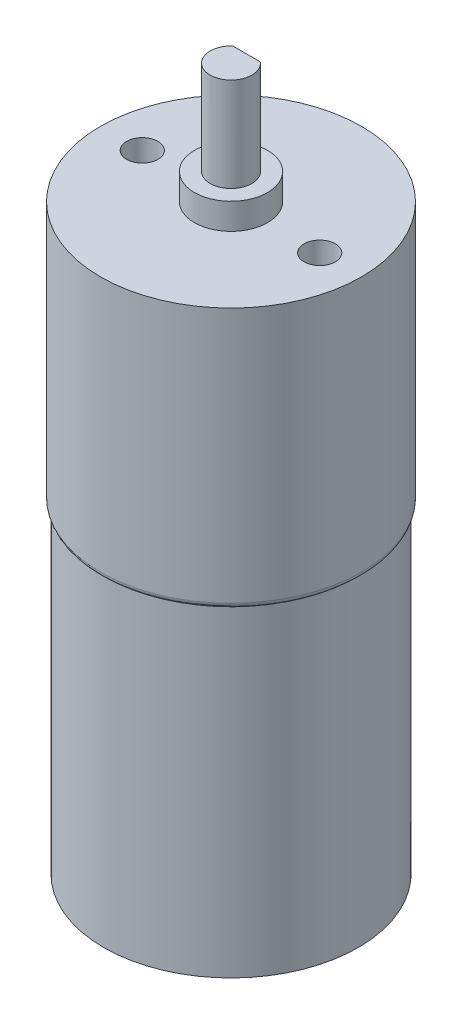
from build123d import *

# Parameters (mm, degrees)
SKETCH1_R           = 12.5
BOSS_EXTRUDE1_DEPTH = 25
FILLET1_R           = 0.5
SKETCH3_R           = 12.2
BOSS_EXTRUDE2_DEPTH = 30.8
SKETCH4_R           = 3.5
BOSS_EXTRUDE3_DEPTH = 2.5
SKETCH5_R           = 2
BOSS_EXTRUDE4_DEPTH = 9
CUT_EXTRUDE1_START  = -8
CUT_EXTRUDE1_DEPTH  = 8
SKETCH7_R           = 1.5
CUT_EXTRUDE2_DEPTH  = 5


with BuildPart() as part:
    # Sketch1 → Boss-Extrude1 (new body)
    with BuildSketch(Plane(origin=(0, 0, 0), x_dir=(1, 0, 0), z_dir=(0, 1, 0))):
        Circle(SKETCH1_R)
    extrude(amount=BOSS_EXTRUDE1_DEPTH)

    # Fillet1
    fillet1_edges = [part.edges().sort_by_distance(p)[0] for p in [
        (-12.5, 0, 0),
    ]]
    fillet(fillet1_edges, radius=FILLET1_R)

    # Sketch3 → Boss-Extrude2 (add)
    with BuildSketch(Plane.XZ):
        Circle(SKETCH3_R)
    extrude(amount=BOSS_EXTRUDE2_DEPTH)

    # Sketch4 → Boss-Extrude3 (add)
    with BuildSketch(Plane(origin=(0, 25, 0), x_dir=(1, 0, 0), z_dir=(0, 1, 0))):
        Circle(SKETCH4_R)
    extrude(amount=BOSS_EXTRUDE3_DEPTH)

    # Sketch5 → Boss-Extrude4 (add)
    with BuildSketch(Plane(origin=(0, 27.5, 0), x_dir=(1, 0, 0), z_dir=(0, 1, 0))):
        Circle(SKETCH5_R)
    extrude(amount=BOSS_EXTRUDE4_DEPTH)

    # Sketch6 → Cut-Extrude1 (cut)
    with BuildSketch(Plane(origin=(0, 36.5, 0), x_dir=(1, 0, 0), z_dir=(0, 1, 0)).offset(CUT_EXTRUDE1_START)):
        with BuildLine():
            Line((1.322875656, 1.5), (-1.322875656, 1.5))
            ThreePointArc((-1.322875656, 1.5), (0, 2), (1.322875656, 1.5))
        make_face()
    extrude(amount=CUT_EXTRUDE1_DEPTH, mode=Mode.SUBTRACT)

    # Sketch7 → Cut-Extrude2 (cut)
    with BuildSketch(Plane(origin=(0, 25, 0), x_dir=(1, 0, 0), z_dir=(0, 1, 0))):
        with Locations((-8.5, 0)):
            Circle(SKETCH7_R)
        with Locations((8.5, 0)):
            Circle(SKETCH7_R)
    extrude(amount=-CUT_EXTRUDE2_DEPTH, mode=Mode.SUBTRACT)


solid = part.part
